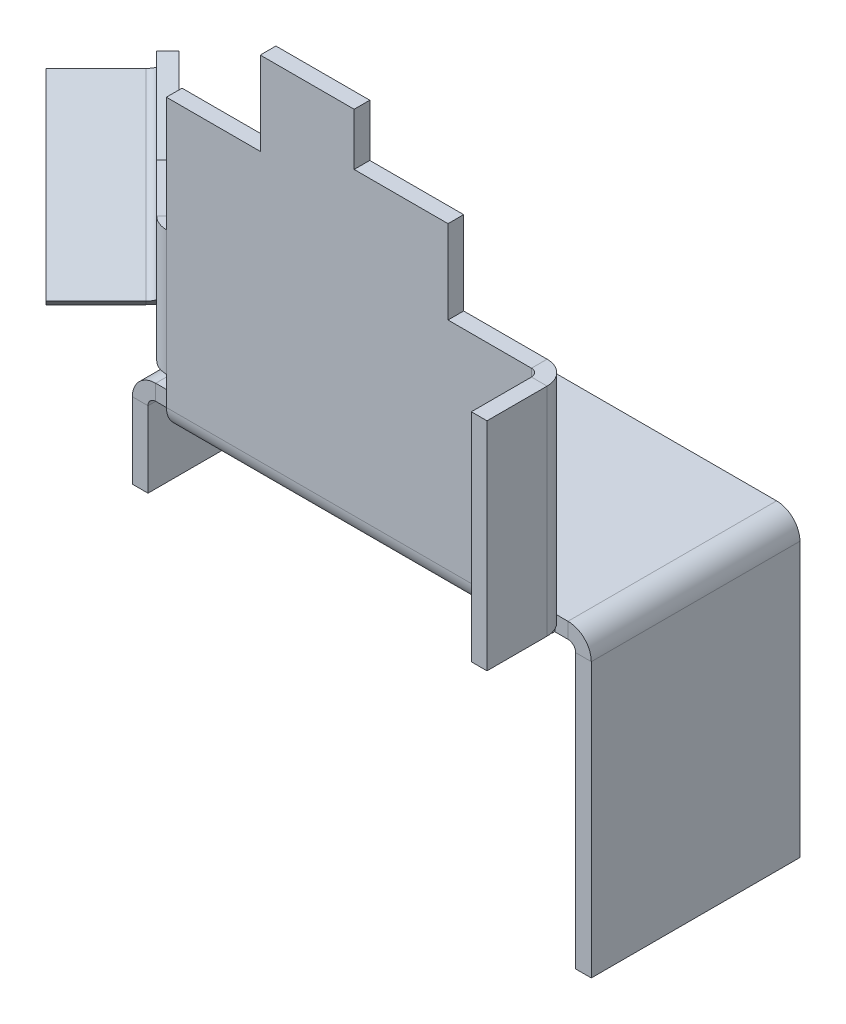
from build123d import *

# Parameters (mm, degrees)
CROQUIS2_W                         = 44
CROQUIS2_H                         = 20
BRIDA_BASE1_DEPTH                  = 1.5
BRIDA_DE_ARISTA1_STRIP_W           = 7.4732
BRIDA_DE_ARISTA1_STRIP_H           = 1.5
BRIDA_DE_ARISTA1_STRIP_CUT_DEPTH   = 20
BRIDA_DE_ARISTA1_STRIP_2_W         = 7.4732
BRIDA_DE_ARISTA1_STRIP_2_H         = 1.5
BRIDA_DE_ARISTA1_STRIP_CUT_2_DEPTH = 20
BRIDA_DE_ARISTA1_DEPTH             = 20
BRIDA_DE_ARISTA1_BEND_DEPTH        = 20
CROQUIS13_W                        = 20
CROQUIS13_H                        = 19
CORTAR_EXTRUIR1_DEPTH              = 2
BRIDA_DE_ARISTA2_DEPTH             = 39.5268
CORTAR_EXTRUIR2_START              = -22.2366
CORTAR_EXTRUIR2_OUTLINE_W          = 3.2634
CORTAR_EXTRUIR2_OUTLINE_H          = 39
CORTAR_EXTRUIR2_OUTLINE_W_2        = 1.2634
CORTAR_EXTRUIR2_DEPTH              = 2.2366
CROQUIS38_W                        = 9
CROQUIS38_H                        = 8
CORTAR_EXTRUIR3_DEPTH              = 35
BRIDA_DE_ARISTA3_DEPTH             = 20.7634
BRIDA_DE_ARISTA6_DEPTH             = 25.7634
CROQUIS51_W                        = 6.573569946
CROQUIS51_H                        = 2.7634
CROQUIS51_H_2                      = 11
CORTAR_EXTRUIR4_DEPTH              = 2
SALIENTE_EXTRUIR1_DEPTH            = 1.5
CORTAR_EXTRUIR5_DEPTH              = 51.641612746
CORTAR_EXTRUIR5_DEPTH_BACK         = 51.641612746
CROQUIS53_W                        = 1.581515027
CROQUIS53_H                        = 11
CROQUIS53_H_2                      = 2.7634
BRIDA_DE_ARISTA7_STRIP_W           = 7.4732
BRIDA_DE_ARISTA7_STRIP_H           = 1.5
BRIDA_DE_ARISTA7_STRIP_CUT_DEPTH   = 16
BRIDA_DE_ARISTA7_RELIEF_W          = 8.2232
BRIDA_DE_ARISTA7_RELIEF_H          = 0.75
BRIDA_DE_ARISTA7_RELIEF_CUT_DEPTH  = 1.5
BRIDA_DE_ARISTA7_DEPTH             = 16


# Read off the part's stored shape, not the designer's step: Cortar-Extruir2
# Sheet-metal steps are written as plain solids
with BuildPart() as part:
    # Croquis2 → Brida base1 (new body)
    with BuildSketch(Plane(origin=(0, 0, 0), x_dir=(1, 0, 0), z_dir=(0, 1, 0))):
        Rectangle(CROQUIS2_W, CROQUIS2_H)
    extrude(amount=-BRIDA_BASE1_DEPTH)

    # Brida de arista1 strip (across the edge) → Brida de arista1 strip cut (cut)
    with BuildSketch(Plane(origin=(-22, -1.5, 10), x_dir=(1, 0, 0), z_dir=(0, 0, -1))):
        with Locations((-1.5, -0.75)):
            Rectangle(BRIDA_DE_ARISTA1_STRIP_W, BRIDA_DE_ARISTA1_STRIP_H)
    extrude(amount=BRIDA_DE_ARISTA1_STRIP_CUT_DEPTH, mode=Mode.SUBTRACT)

    # Brida de arista1 strip 2 (across the edge) → Brida de arista1 strip cut 2 (cut)
    with BuildSketch(Plane(origin=(22, -1.5, -10), x_dir=(-1, 0, 0), z_dir=(0, 0, 1))):
        with Locations((-1.5, -0.75)):
            Rectangle(BRIDA_DE_ARISTA1_STRIP_2_W, BRIDA_DE_ARISTA1_STRIP_2_H)
    extrude(amount=BRIDA_DE_ARISTA1_STRIP_CUT_2_DEPTH, mode=Mode.SUBTRACT)

    # Brida de arista1 section (across the edge) → Brida de arista1 (add)
    with BuildSketch(Plane(origin=(-22, -1.5, 10), x_dir=(1, 0, 0), z_dir=(0, 0, -1))):
        with BuildLine():
            Line((0, 0.7366), (0, 27))
            Line((0, 27), (1.5, 27))
            Line((1.5, 27), (1.5, 0.7366))
            ThreePointArc((1.5, 0.7366), (1.715745145, 0.215745145), (2.2366, 0))
            Line((2.2366, 0), (2.2366, -1.5))
            ThreePointArc((2.2366, -1.5), (0.655084973, -0.844915027), (0, 0.7366))
        make_face()
    extrude(amount=BRIDA_DE_ARISTA1_DEPTH)

    # Brida de arista1 section 2 (across the edge) → Brida de arista1 bend (add)
    with BuildSketch(Plane(origin=(22, -1.5, -10), x_dir=(-1, 0, 0), z_dir=(0, 0, 1))):
        with BuildLine():
            Line((0, 0.7366), (0, 27))
            Line((0, 27), (1.5, 27))
            Line((1.5, 27), (1.5, 0.7366))
            ThreePointArc((1.5, 0.7366), (1.715745145, 0.215745145), (2.2366, 0))
            Line((2.2366, 0), (2.2366, -1.5))
            ThreePointArc((2.2366, -1.5), (0.655084973, -0.844915027), (0, 0.7366))
        make_face()
    extrude(amount=BRIDA_DE_ARISTA1_BEND_DEPTH)

    # Croquis13 → Cortar-Extruir1 (cut)
    with BuildSketch(Plane.ZY.offset(22)):
        with Locations((0, -19)):
            Rectangle(CROQUIS13_W, CROQUIS13_H)
    extrude(amount=-CORTAR_EXTRUIR1_DEPTH, mode=Mode.SUBTRACT)

    # Brida de arista2 section (across the edge) → Brida de arista2 (add)
    with BuildSketch(Plane(origin=(-19.7634, 0, 10.7366), x_dir=(0, 0, -1), z_dir=(1, 0, 0))):
        with BuildLine():
            Line((-1.5, 0.7366), (-1.5, 34.5))
            Line((-1.5, 34.5), (0, 34.5))
            Line((0, 34.5), (0, 0.7366))
            ThreePointArc((0, 0.7366), (0.215745145, 0.215745145), (0.7366, 0))
            Line((0.7366, 0), (0.7366, -1.5))
            ThreePointArc((0.7366, -1.5), (-0.844915027, -0.844915027), (-1.5, 0.7366))
        make_face()
    extrude(amount=BRIDA_DE_ARISTA2_DEPTH)

    # Cortar-Extruir2 outline → Cortar-Extruir2 (cut)
    with BuildSketch(Plane(origin=(0, 0, -10), x_dir=(-1, 0, 0), z_dir=(0, 0, -1)).offset(CORTAR_EXTRUIR2_START)):
        with Locations((18.1317, 16.5)):
            Rectangle(CORTAR_EXTRUIR2_OUTLINE_W, CORTAR_EXTRUIR2_OUTLINE_H)
        with Locations((-19.1317, 16.5)):
            Rectangle(CORTAR_EXTRUIR2_OUTLINE_W_2, CORTAR_EXTRUIR2_OUTLINE_H)
    extrude(amount=CORTAR_EXTRUIR2_DEPTH, mode=Mode.SUBTRACT)

    # Croquis38 → Cortar-Extruir3 (cut)
    with BuildSketch(Plane(origin=(0, 0, 10.7366), x_dir=(-1, 0, 0), z_dir=(0, 0, -1))):
        with Locations((12, 30.5)):
            Rectangle(CROQUIS38_W, CROQUIS38_H)
        Polygon((-1.5, 34.5), (-10.5, 34.5), (-18.5, 34.5), (-18.5, 21.5), (-10.5, 21.5), (-10.5, 29.5), (-1.5, 29.5), align=None)
    extrude(amount=-CORTAR_EXTRUIR3_DEPTH, mode=Mode.SUBTRACT)

    # Brida de arista3 section (across the edge) → Brida de arista3 (add)
    with BuildSketch(Plane(origin=(19.2366, 0.7366, 12.2366), x_dir=(-1, 0, 0), z_dir=(0, 1, 0))):
        with BuildLine():
            Line((-1.5, 0.7366), (-1.5, 6.5))
            Line((-1.5, 6.5), (0, 6.5))
            Line((0, 6.5), (0, 0.7366))
            ThreePointArc((0, 0.7366), (0.215745145, 0.215745145), (0.7366, 0))
            Line((0.7366, 0), (0.7366, -1.5))
            ThreePointArc((0.7366, -1.5), (-0.844915027, -0.844915027), (-1.5, 0.7366))
        make_face()
    extrude(amount=BRIDA_DE_ARISTA3_DEPTH)

    # Brida de arista6 section (across the edge) → Brida de arista6 (add)
    with BuildSketch(Plane(origin=(-16.80510971, 0.7366, 10.7366), x_dir=(0.7071067811865438, 0, -0.7071067811865512), z_dir=(0, 1, 0))):
        with BuildLine():
            Line((-1.5, 0.30510971), (-1.5, 6.878679656))
            Line((-1.5, 6.878679656), (0, 6.878679656))
            Line((0, 6.878679656), (0, 0.30510971))
            ThreePointArc((0, 0.30510971), (0.056070336, 0.023225094), (0.215745145, -0.215745145))
            Line((0.215745145, -0.215745145), (-0.844915027, -1.276405317))
            ThreePointArc((-0.844915027, -1.276405317), (-1.329748962, -0.550800055), (-1.5, 0.30510971))
        make_face()
    extrude(amount=BRIDA_DE_ARISTA6_DEPTH)

    # Croquis51 → Cortar-Extruir4 (cut)
    with BuildSketch(Plane(origin=(-13.770854855, 0, 13.770854855), x_dir=(-0.7071067811865513, 0, -0.7071067811865438), z_dir=(0.7071067811865438, 0, -0.7071067811865513))):
        with Locations((7.882979051, 2.1183)):
            Rectangle(CROQUIS51_W, CROQUIS51_H)
        with Locations((7.882979051, 21)):
            Rectangle(CROQUIS51_W, CROQUIS51_H_2)
    extrude(amount=-CORTAR_EXTRUIR4_DEPTH, mode=Mode.SUBTRACT)

    # Croquis52 → Saliente-Extruir1 (add)
    with BuildSketch(Plane(origin=(-13.770854855, 0, 13.770854855), x_dir=(-0.7071067811865513, 0, -0.7071067811865438), z_dir=(0.7071067811865438, 0, -0.7071067811865513))):
        Polygon((11.169764024, 15.5), (16.483472523, 20.813708499), (22.483472523, 14.813708499), (11.169764024, 3.5), align=None)
    extrude(amount=-SALIENTE_EXTRUIR1_DEPTH)

    # Croquis53 → Cortar-Extruir5 (cut, two sides: drawn at the far end of the back side and taken through both)
    with BuildSketch(Plane(origin=(0, 0, 10.7366), x_dir=(-1, 0, 0), z_dir=(0, 0, -1)).offset(-CORTAR_EXTRUIR5_DEPTH_BACK)):
        with Locations((17.290757514, 21)):
            Rectangle(CROQUIS53_W, CROQUIS53_H)
        with Locations((17.290757514, 2.1183)):
            Rectangle(CROQUIS53_W, CROQUIS53_H_2)
    extrude(amount=CORTAR_EXTRUIR5_DEPTH + CORTAR_EXTRUIR5_DEPTH_BACK, mode=Mode.SUBTRACT)

    # Brida de arista7 strip (across the edge) → Brida de arista7 strip cut (cut)
    with BuildSketch(Plane(origin=(-30.729730913, 14.813708499, -1.066700859), x_dir=(0.5000000000000012, 0.7071067811865457, 0.5000000000000013), z_dir=(0.5000000000000016, -0.7071067811865495, 0.49999999999999595))):
        with Locations((-1.5, -0.75)):
            Rectangle(BRIDA_DE_ARISTA7_STRIP_W, BRIDA_DE_ARISTA7_STRIP_H)
    extrude(amount=BRIDA_DE_ARISTA7_STRIP_CUT_DEPTH, mode=Mode.SUBTRACT)

    # Brida de arista7 relief (on the sheet) → Brida de arista7 relief cut (cut)
    with BuildSketch(Plane(origin=(-29.611430913, 16.395223526, 0.051599141), x_dir=(0.4999999999999988, 0.7071067811865457, 0.5000000000000038), z_dir=(-0.7071067811865475, -5.355429995107666e-15, 0.7071067811865478))):
        with Locations((-3.3616, -16.375)):
            Rectangle(BRIDA_DE_ARISTA7_RELIEF_W, BRIDA_DE_ARISTA7_RELIEF_H)
    extrude(amount=-BRIDA_DE_ARISTA7_RELIEF_CUT_DEPTH, mode=Mode.SUBTRACT)

    # Brida de arista7 section (across the edge) → Brida de arista7 (add)
    with BuildSketch(Plane(origin=(-30.729730913, 14.813708499, -1.066700859), x_dir=(0.5000000000000012, 0.7071067811865457, 0.5000000000000013), z_dir=(0.5000000000000016, -0.7071067811865495, 0.49999999999999595))):
        with BuildLine():
            Line((0, 0.7366), (0, 7.5))
            Line((0, 7.5), (1.5, 7.5))
            Line((1.5, 7.5), (1.5, 0.7366))
            ThreePointArc((1.5, 0.7366), (1.715745145, 0.215745145), (2.2366, 0))
            Line((2.2366, 0), (2.2366, -1.5))
            ThreePointArc((2.2366, -1.5), (0.655084973, -0.844915027), (0, 0.7366))
        make_face()
    extrude(amount=BRIDA_DE_ARISTA7_DEPTH)


solid = part.part
